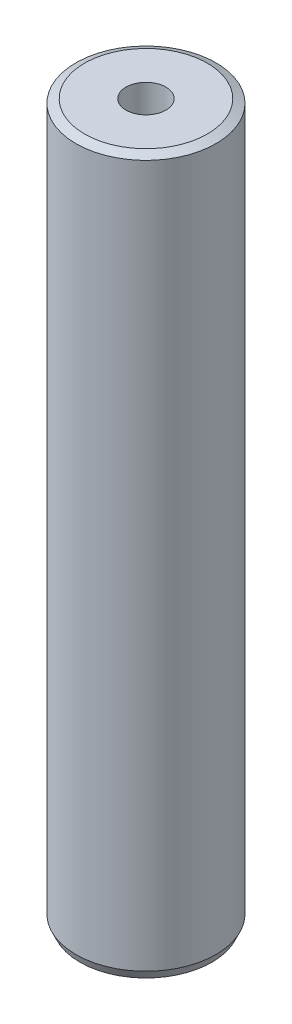
from build123d import *
from OCP.BRepFilletAPI import BRepFilletAPI_MakeChamfer

# Parameters (mm, degrees)
SKETCH1_R           = 5
BOSS_EXTRUDE1_DEPTH = 51.02396475
SKETCH2_R           = 1.425325232
CUT_EXTRUDE1_DEPTH  = 52.51160043
CHAMFER1_SIZE       = 0.284699517
CHAMFER1_SIZE2      = 0.617855337


with BuildPart() as part:
    # Sketch1 → Boss-Extrude1 (new body)
    with BuildSketch(Plane(origin=(0, 0, 0), x_dir=(1, 0, 0), z_dir=(0, 1, 0))):
        Circle(SKETCH1_R)
    extrude(amount=BOSS_EXTRUDE1_DEPTH)

    # Sketch2 → Cut-Extrude1 (cut, through all)
    with BuildSketch(Plane(origin=(0, 0, 0), x_dir=(1, 0, 0), z_dir=(0, 1, 0))):
        Circle(SKETCH2_R)
    extrude(amount=CUT_EXTRUDE1_DEPTH, mode=Mode.SUBTRACT)

    # Chamfer1: one chamfer whose edges measure the first distance from different faces: ONE call of the kernel's chamfer builder (chamfer() names one face for all edges)
    chamfer1_edges_1 = [part.edges().sort_by_distance(p)[0] for p in [
        (-5, 51.02396475, 0),
    ]]
    chamfer1_side_1 = [part.faces().sort_by_distance(p)[0] for p in [
        (-5, 25.511982375, 0),
    ]]
    chamfer1_edges_2 = [part.edges().sort_by_distance(p)[0] for p in [
        (-5, 0, 0),
    ]]
    chamfer1_side_2 = [part.faces().sort_by_distance(p)[0] for p in [
        (-4.858578644, 0, 0),
    ]]
    chamfer1 = BRepFilletAPI_MakeChamfer(part.part.solid().wrapped)
    for e in chamfer1_edges_1:
        chamfer1.Add(CHAMFER1_SIZE, CHAMFER1_SIZE2, e.wrapped, chamfer1_side_1[0].wrapped)  # the first distance lies on this face
    for e in chamfer1_edges_2:
        chamfer1.Add(CHAMFER1_SIZE, CHAMFER1_SIZE2, e.wrapped, chamfer1_side_2[0].wrapped)  # the first distance lies on this face
    add(Compound.cast(chamfer1.Shape()), mode=Mode.REPLACE)


solid = part.part
